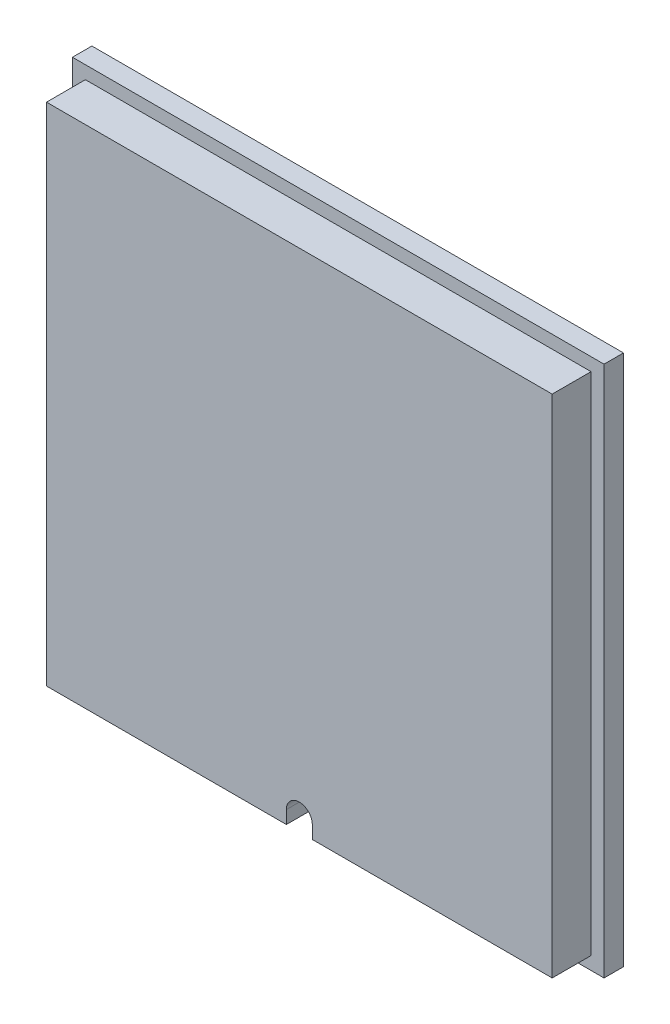
from build123d import *

# Parameters (mm, degrees)
SKETCH1_W           = 78
SKETCH1_H           = 78
BOSS_EXTRUDE1_DEPTH = 9
SKETCH2_W           = 82
SKETCH2_H           = 82
BOSS_EXTRUDE2_DEPTH = 3
CUT_EXTRUDE1_DEPTH  = 59.677082409


with BuildPart() as part:
    # Sketch1 → Boss-Extrude1 (new body)
    with BuildSketch(Plane.XY):
        Rectangle(SKETCH1_W, SKETCH1_H)
    extrude(amount=BOSS_EXTRUDE1_DEPTH)

    # Sketch2 → Boss-Extrude2 (add)
    with BuildSketch(Plane.XY):
        Rectangle(SKETCH2_W, SKETCH2_H)
    extrude(amount=BOSS_EXTRUDE2_DEPTH)

    # Sketch3 → Cut-Extrude1 (cut, through all)
    with BuildSketch(Plane.XY.offset(9)):
        with BuildLine():
            Line((2, -37), (2, -41))
            ThreePointArc((2, -41), (0, -43), (-2, -41))
            Line((-2, -41), (-2, -37))
            ThreePointArc((-2, -37), (0, -35), (2, -37))
        make_face()
    extrude(amount=-CUT_EXTRUDE1_DEPTH, mode=Mode.SUBTRACT)


solid = part.part
